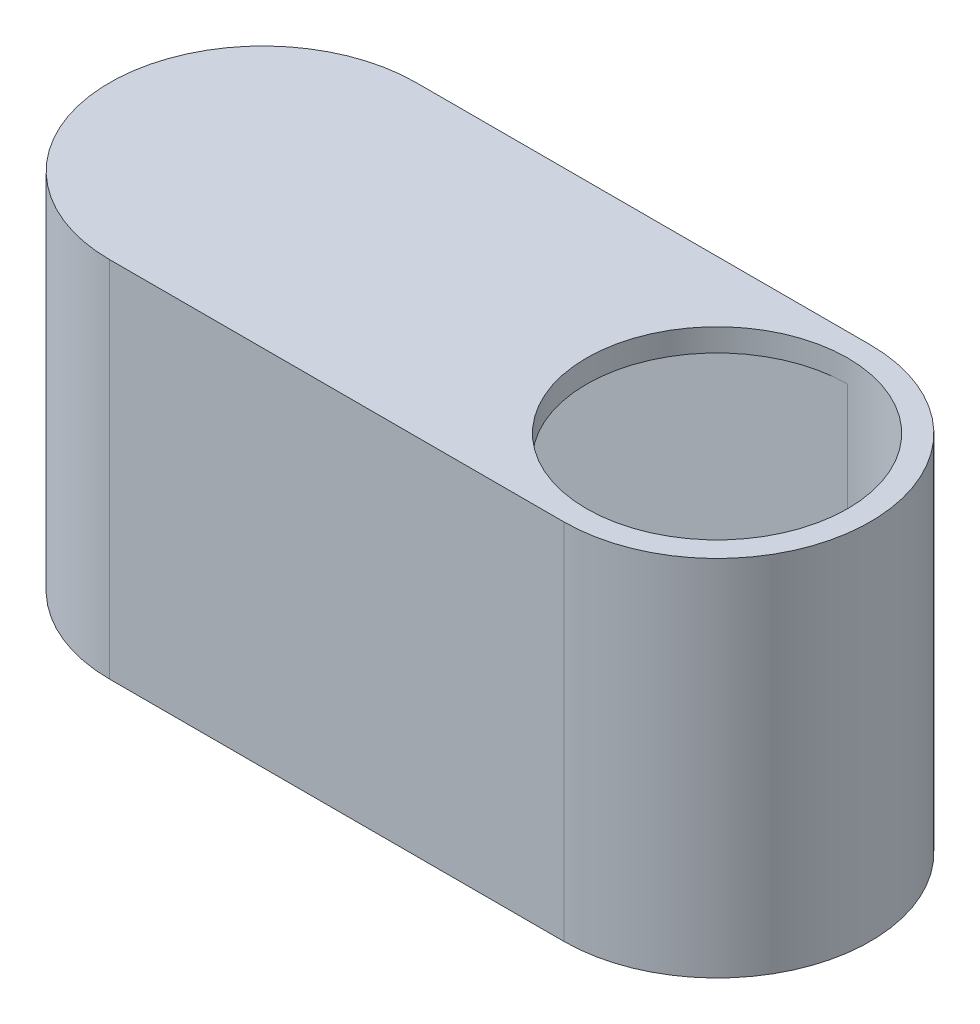
from build123d import *
from build123d.topology import SkipClean

# Parameters (mm, degrees)
BOSS_EXTRUDE1_DEPTH = 30
SKETCH3_R           = 11.5
BOSS_EXTRUDE2_DEPTH = 2


with BuildPart() as part:
    # Sketch2 → Boss-Extrude1 (new body)
    with BuildSketch(Plane(origin=(0, 0, 0), x_dir=(1, 0, 0), z_dir=(0, 1, 0))):
        with BuildLine():
            Line((77.29844251, 40.18564095), (117.29844251, 40.18564095))
            ThreePointArc((117.29844251, 40.18564095), (130.79844251, 53.68564095), (117.29844251, 67.18564095))
            Line((117.29844251, 67.18564095), (77.29844251, 67.18564095))
            ThreePointArc((77.29844251, 67.18564095), (63.79844251, 53.68564095), (77.29844251, 40.18564095))
        make_face()
        with BuildLine():
            Line((77.29844251, 65.18564095), (117.29844251, 65.18564095))
            ThreePointArc((117.29844251, 65.18564095), (128.79844251, 53.68564095), (117.29844251, 42.18564095))
            Line((117.29844251, 42.18564095), (77.29844251, 42.18564095))
            ThreePointArc((77.29844251, 42.18564095), (65.79844251, 53.68564095), (77.29844251, 65.18564095))
        make_face(mode=Mode.SUBTRACT)
    extrude(amount=BOSS_EXTRUDE1_DEPTH)

    # Sketch3 → Boss-Extrude2 (add)
    with SkipClean():  # the faces are left unmerged after this step: merging them gives an invalid solid
        with BuildSketch(Plane(origin=(0, 30, 0), x_dir=(1, 0, 0), z_dir=(0, 1, 0))):
            with BuildLine():
                Line((77.29844251, 67.18564095), (117.29844251, 67.18564095))
                ThreePointArc((117.29844251, 67.18564095), (130.79844251, 53.68564095), (117.29844251, 40.18564095))
                Line((117.29844251, 40.18564095), (77.29844251, 40.18564095))
                ThreePointArc((77.29844251, 40.18564095), (63.79844251, 53.68564095), (77.29844251, 67.18564095))
            make_face()
            with Locations((117.29844251, 53.68564095)):
                Circle(SKETCH3_R, mode=Mode.SUBTRACT)
        extrude(amount=BOSS_EXTRUDE2_DEPTH)


solid = part.part
